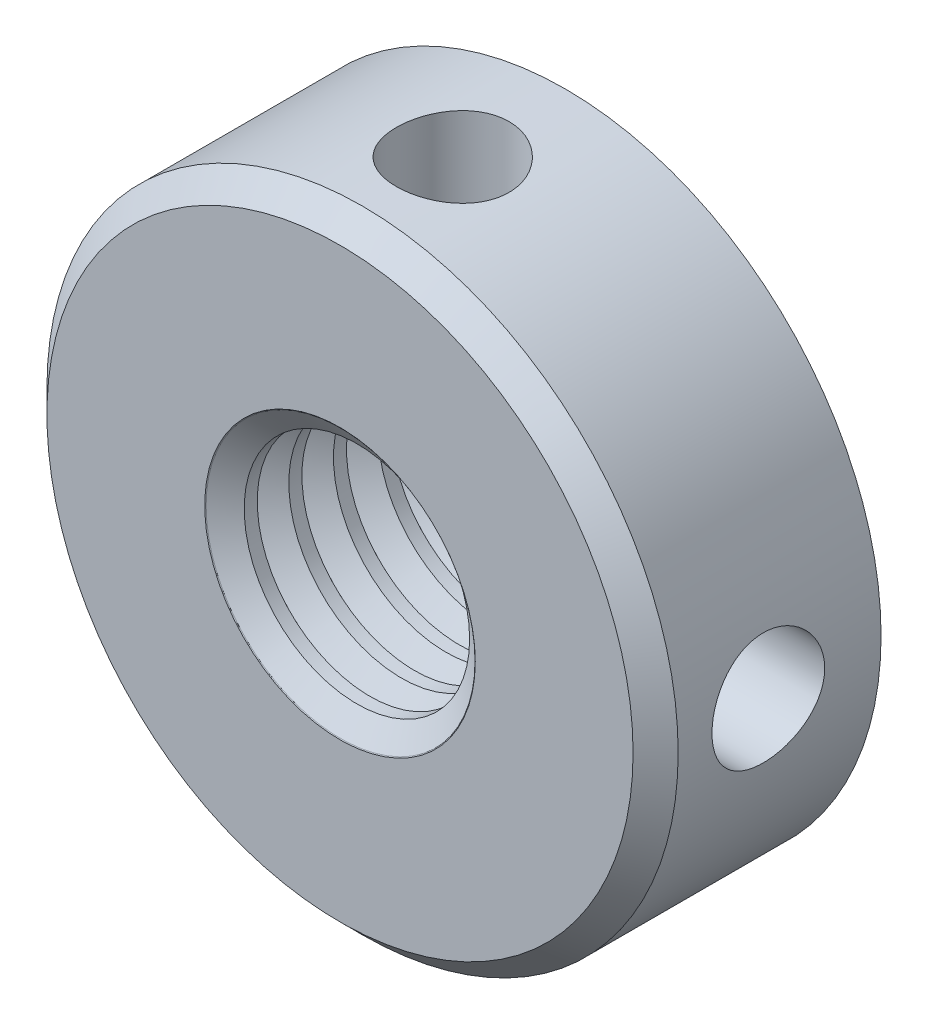
from build123d import *

# Parameters (mm, degrees)
BASENUTSKE_R    = 7
BASENUTSKE_R_2  = 2.5
BASENUT_DEPTH   = 5
HOLES_COUNT     = 4
THDSCHPAT_COUNT = 6
THDSCHPAT_PITCH = 0.98984


with BuildPart() as part:
    # BaseNutSke → BaseNut (new body)
    with BuildSketch(Plane.XY):
        Circle(BASENUTSKE_R)
        Circle(BASENUTSKE_R_2, mode=Mode.SUBTRACT)
    extrude(amount=-BASENUT_DEPTH)

    # Chamfer1: read off the stored shape, not the designer's step
    # Chamfer1 outline → Chamfer1 (revolve, cut)
    with BuildSketch(Plane.XZ):
        Polygon((2.5, 0), (2.5, -0.350103769), (3, 0), align=None)
        Polygon((7, 0), (6.5, 0), (7, -0.5), align=None)
        Polygon((3, -4.9746), (2.5, -4.624496231), (2.5, -5), (3, -5), align=None)
    revolve(axis=Axis((0, 0, 0), (0, 0, 1)), mode=Mode.SUBTRACT)

    # HoleSke → Hole (revolve, cut)
    with BuildSketch(Plane(origin=(0, 0, 0), x_dir=(0, 0, -1), z_dir=(1, 0, 0)), mode=Mode.PRIVATE) as hole_sk:
        Polygon((2.5, 7), (2.5, 3.282233047), (3.75, 3.8), (3.75, 7), align=None)
    hole = revolve(hole_sk.sketch.rotate(Axis((0, 4.7625, -2.5), (0, -1, 0)), 180), axis=Axis((0, 4.7625, -2.5), (0, -1, 0)), mode=Mode.SUBTRACT)

    # Holes: Hole ×4 about axis
    holes_axis = Axis((0, 0, 0), (0, 0, 1))
    for i in range(1, HOLES_COUNT):
        add(hole.rotate(holes_axis, i * 360 / HOLES_COUNT), mode=Mode.SUBTRACT)

    # ThdSchSke → ThreadSchematic (revolve, cut)
    with BuildSketch(Plane(origin=(0, 0, 0), x_dir=(1, 0, 0), z_dir=(0, 1, 0)), mode=Mode.PRIVATE) as threadschematic_sk:
        Polygon((-3, 0.025), (-2.5, 0.375103769), (-1.25, 0.375103769), (-1.25, -0.325103769), (-2.5, -0.325103769), align=None)
    threadschematic = revolve(threadschematic_sk.sketch.rotate(Axis((0, 0, -0.525), (0, 0, -1)), 180), axis=Axis((0, 0, -0.525), (0, 0, -1)), mode=Mode.SUBTRACT)

    # ThdSchPat: ThreadSchematic ×6
    with Locations(*[(0, 0, -i * THDSCHPAT_PITCH) for i in range(1, THDSCHPAT_COUNT)]):
        add(threadschematic, mode=Mode.SUBTRACT)


solid = part.part
